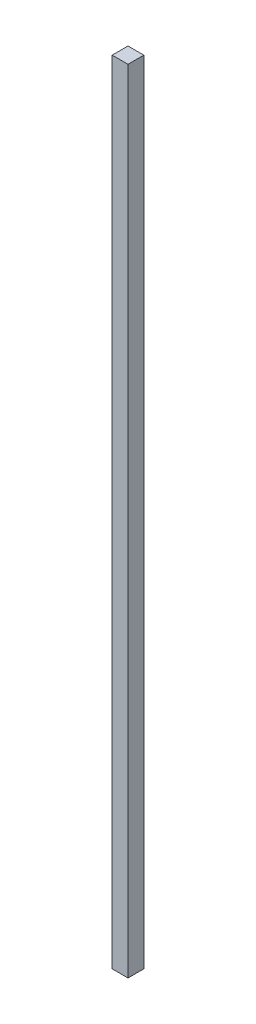
from build123d import *

# Parameters (mm, degrees)
SKIZZE1_W                       = 50
SKIZZE1_H                       = 50
AUFSATZ_LINEAR_AUSTRAGEN1_DEPTH = 2500


with BuildPart() as part:
    # Skizze1 → Aufsatz-Linear austragen1 (new body)
    with BuildSketch(Plane(origin=(0, 0, 0), x_dir=(1, 0, 0), z_dir=(0, 1, 0))):
        with Locations((25, 25)):
            Rectangle(SKIZZE1_W, SKIZZE1_H)
    extrude(amount=AUFSATZ_LINEAR_AUSTRAGEN1_DEPTH)


solid = part.part
